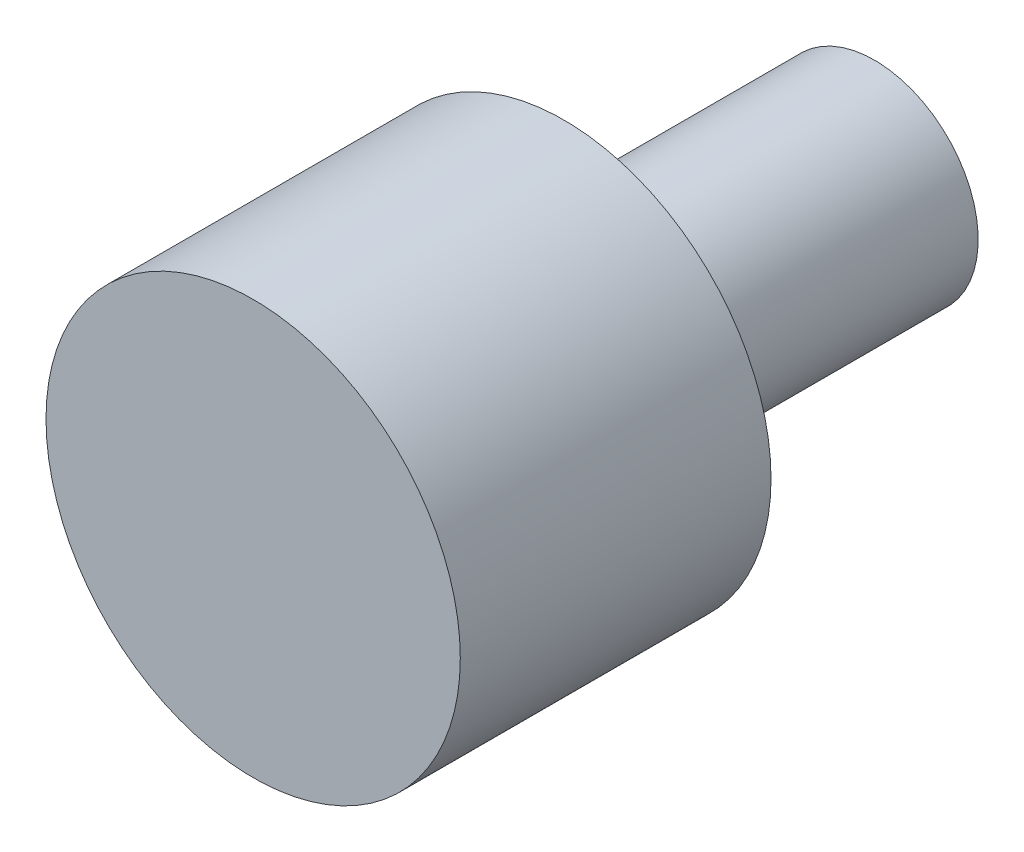
from build123d import *

# Parameters (mm, degrees)
SKETCH1_R           = 20
BOSS_EXTRUDE1_DEPTH = 30
SKETCH2_R           = 10
BOSS_EXTRUDE2_DEPTH = 30


with BuildPart() as part:
    # Sketch1 → Boss-Extrude1 (new body)
    with BuildSketch(Plane.XY):
        Circle(SKETCH1_R)
    extrude(amount=BOSS_EXTRUDE1_DEPTH)

    # Sketch2 → Boss-Extrude2 (add)
    with BuildSketch(Plane(origin=(0, 0, 0), x_dir=(-1, 0, 0), z_dir=(0, 0, -1))):
        Circle(SKETCH2_R)
    extrude(amount=BOSS_EXTRUDE2_DEPTH)


solid = part.part
